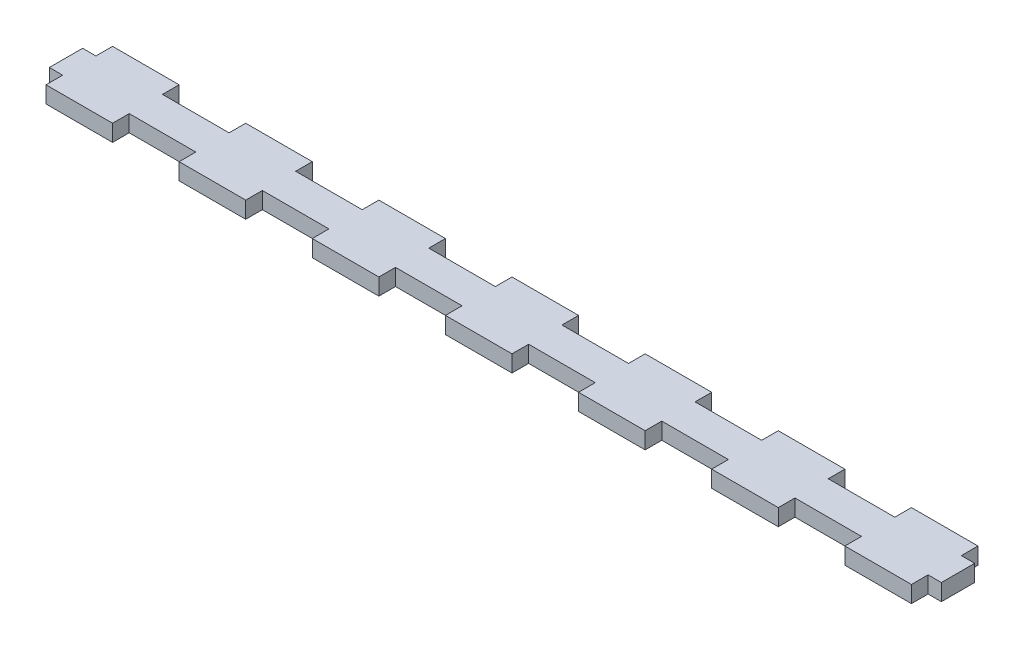
from build123d import *

# Parameters (mm, degrees)
BOSS_EXTRUDE1_DEPTH = 1.25


with BuildPart() as part:
    # Sketch1 → Boss-Extrude1 (new, symmetric)
    with BuildSketch(Plane(origin=(0, 0, 0), x_dir=(1, 0, 0), z_dir=(0, 1, 0))):
        Polygon((-67, 2.5), (-65, 2.5), (-65, 5), (-55, 5), (-55, 2.5), (-45, 2.5), (-45, 5), (-35, 5), (-35, 2.5), (-25, 2.5), (-25, 5), (-15, 5), (-15, 2.5), (-5, 2.5), (-5, 5), (5, 5), (5, 2.5), (15, 2.5), (15, 5), (25, 5), (25, 2.5), (35, 2.5), (35, 5), (45, 5), (45, 2.5), (55, 2.5), (55, 5), (65, 5), (65, 2.5), (67, 2.5), (67, -2.5), (65, -2.5), (65, -5), (55, -5), (55, -2.5), (45, -2.5), (45, -5), (35, -5), (35, -2.5), (25, -2.5), (25, -5), (15, -5), (15, -2.5), (5, -2.5), (5, -5), (-5, -5), (-5, -2.5), (-15, -2.5), (-15, -5), (-25, -5), (-25, -2.5), (-35, -2.5), (-35, -5), (-45, -5), (-45, -2.5), (-55, -2.5), (-55, -5), (-65, -5), (-65, -2.5), (-67, -2.5), align=None)
    extrude(amount=BOSS_EXTRUDE1_DEPTH, both=True)


solid = part.part
